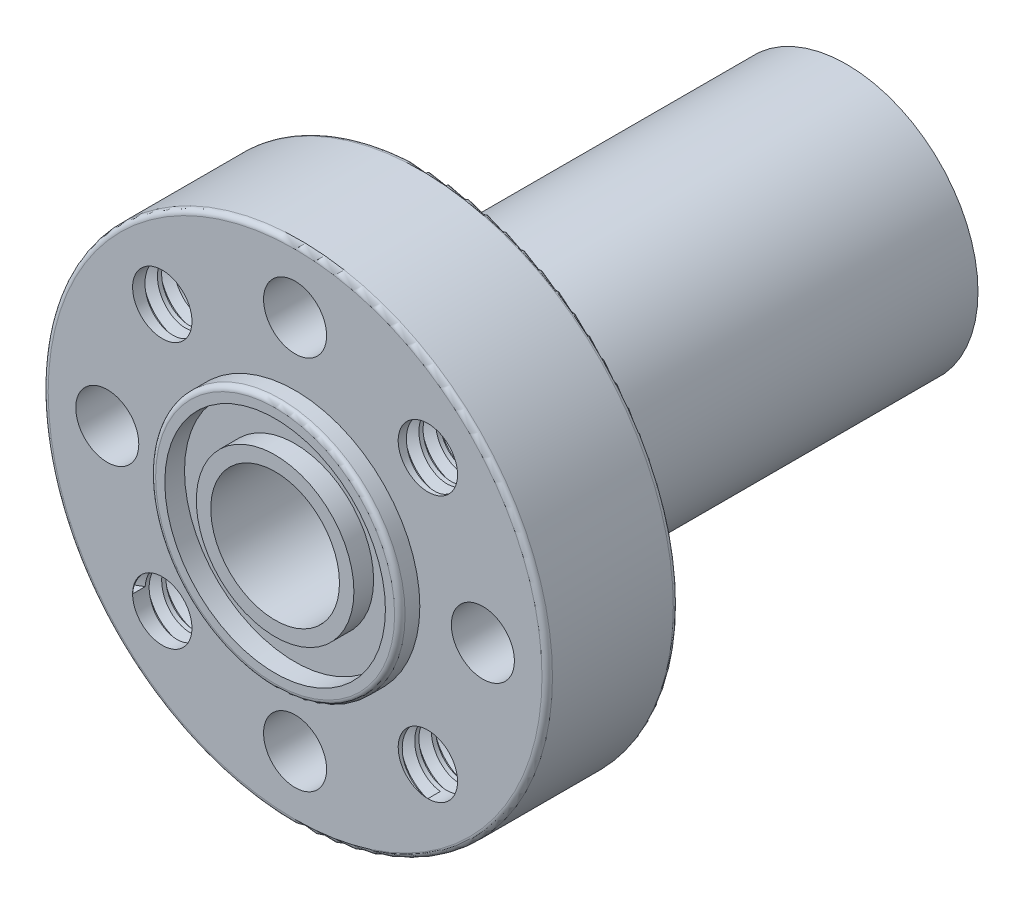
from build123d import *

# Parameters (mm, degrees)
SKETCH1_R           = 9.6
BOSS_EXTRUDE1_DEPTH = 5
SKETCH4_R           = 4.75
BOSS_EXTRUDE4_DEPTH = 0.76
SKETCH5_R           = 2.45
CUT_EXTRUDE2_DEPTH  = 15.747799836
SKETCH6_R           = 4.2
SKETCH6_R_2         = 3
CUT_EXTRUDE3_DEPTH  = 0.75
FILLET1_R           = 0.2
SKETCH7_R           = 1.2
CUT_EXTRUDE5_DEPTH  = 15.467895626
SKETCH9_R           = 1.13
CUT_EXTRUDE4_DEPTH  = 15.467895626
THREAD1_PITCH       = 0.635
CIRPATTERN1_COUNT   = 4
SKETCH21_R          = 5
SKETCH21_R_2        = 4
BOSS_EXTRUDE5_DEPTH = 16


with BuildPart() as part:
    # Sketch1 → Boss-Extrude1 (new body)
    with BuildSketch(Plane.XY):
        Circle(SKETCH1_R)
    extrude(amount=BOSS_EXTRUDE1_DEPTH)

    # Sketch4 → Boss-Extrude4 (add)
    with BuildSketch(Plane.XY.offset(5)):
        Circle(SKETCH4_R)
    extrude(amount=BOSS_EXTRUDE4_DEPTH)

    # Sketch5 → Cut-Extrude2 (cut, through all)
    with BuildSketch(Plane.XY.offset(5.76)):
        Circle(SKETCH5_R)
    extrude(amount=-CUT_EXTRUDE2_DEPTH, mode=Mode.SUBTRACT)

    # Sketch6 → Cut-Extrude3 (cut)
    with BuildSketch(Plane.XY.offset(5.76)):
        Circle(SKETCH6_R)
        Circle(SKETCH6_R_2, mode=Mode.SUBTRACT)
    extrude(amount=-CUT_EXTRUDE3_DEPTH, mode=Mode.SUBTRACT)

    # Fillet1
    fillet1_edges = [part.edges().sort_by_distance(p)[0] for p in [
        (-9.6, 0, 0),
        (-9.6, 0, 5),
        (-4.75, 0, 5.76),
    ]]
    fillet(fillet1_edges, radius=FILLET1_R)

    # Sketch7 → Cut-Extrude5 (cut, through all)
    with BuildSketch(Plane.XY.offset(5)):
        with Locations((0, -7.15)):
            Circle(SKETCH7_R)
    cut_extrude5 = extrude(amount=-CUT_EXTRUDE5_DEPTH, mode=Mode.SUBTRACT)

    # Sketch9 → Cut-Extrude4 (cut, through all)
    with BuildSketch(Plane.XY.offset(5)):
        with Locations((-5.055813485, -5.055813485)):
            Circle(SKETCH9_R)
    cut_extrude4 = extrude(amount=-CUT_EXTRUDE4_DEPTH, mode=Mode.SUBTRACT)

    # Thread1: the profile of Thread Profile2 profile screwed along a right-hand helix of 7.874016 turns, 6 arcs to a turn; built about Z, then put on its axis
    thread1_z = Axis((0, 0, 0), (0, 0, 1))
    thread1_corners = [(1.1297, 0, -0.000173205), (1.473703831, 0, 0.198437499), (1.473703831, 0, 0.277812499), (1.1297, 0, 0.476423203)]
    with BuildLine(mode=Mode.PRIVATE) as thread1_profile:
        Line(thread1_corners[0], thread1_corners[1])
        Line(thread1_corners[1], thread1_corners[2])
        Line(thread1_corners[2], thread1_corners[3])
        Line(thread1_corners[3], thread1_corners[0])
    thread1_cap = Face(thread1_profile.wire())
    thread1_turn_angles = [0, 30, 60, 90, 120, 150, 180, 210, 240, 270, 300, 330, 360]
    thread1_turn_weights = [1, 0.8660254037844387, 1, 0.8660254037844387, 1, 0.8660254037844387, 1, 0.8660254037844387, 1, 0.8660254037844387, 1, 0.8660254037844387, 1]
    thread1_turn_rails = [Edge.make_bspline([Vector(p[0], p[1], 0).rotate(thread1_z, thread1_turn_angles[k]) / thread1_turn_weights[k] + Vector(0, 0, p[2] + THREAD1_PITCH * thread1_turn_angles[k] / 360) for k in range(13)], [0, 0, 0, 1, 1, 2, 2, 3, 3, 4, 4, 5, 5, 6, 6, 6], 2, thread1_turn_weights) for p in thread1_corners]
    thread1_turn_sides = [Face.make_surface_from_curves(thread1_turn_rails[p[0]], thread1_turn_rails[p[1]]) for p in [(0, 1), (1, 2), (2, 3), (3, 0)]]
    thread1_last_angles = [2520, 2550, 2580, 2610, 2640, 2670, 2700, 2730, 2760, 2790, 2820, 2827.322834646, 2834.645669291]
    thread1_last_weights = [1, 0.8660254037844387, 1, 0.8660254037844387, 1, 0.8660254037844387, 1, 0.8660254037844387, 1, 0.8660254037844387, 1, 0.9918437235207201, 1]
    thread1_last_rails = [Edge.make_bspline([Vector(p[0], p[1], 0).rotate(thread1_z, thread1_last_angles[k]) / thread1_last_weights[k] + Vector(0, 0, p[2] + THREAD1_PITCH * thread1_last_angles[k] / 360) for k in range(13)], [0, 0, 0, 1, 1, 2, 2, 3, 3, 4, 4, 5, 5, 6, 6, 6], 2, thread1_last_weights) for p in thread1_corners]
    thread1_last_sides = [Face.make_surface_from_curves(thread1_last_rails[p[0]], thread1_last_rails[p[1]]) for p in [(0, 1), (1, 2), (2, 3), (3, 0)]]
    thread1 = Plane(origin=(-5.055813485, -5.055813485, 5), x_dir=(-1, 0, 0), z_dir=(0, 0, -1)) * Solid(Shell([*[p.moved(Location((0, 0, THREAD1_PITCH * i))) for i in range(7) for p in thread1_turn_sides], *thread1_last_sides, thread1_cap, thread1_cap.rotate(thread1_z, 2834.645669291).moved(Location((0, 0, THREAD1_PITCH * 2834.645669291 / 360)))]))
    add(thread1, mode=Mode.SUBTRACT)

    # CirPattern1: Cut-Extrude5, Cut-Extrude4, Thread1 ×4 about axis
    cirpattern1_axis = Axis((0, 0, 6.394387537), (0, 0, -1))
    add([cut_extrude5.rotate(cirpattern1_axis, i * 360 / CIRPATTERN1_COUNT) for i in range(1, CIRPATTERN1_COUNT)], mode=Mode.SUBTRACT)
    add([cut_extrude4.rotate(cirpattern1_axis, i * 360 / CIRPATTERN1_COUNT) for i in range(1, CIRPATTERN1_COUNT)], mode=Mode.SUBTRACT)
    add([thread1.rotate(cirpattern1_axis, i * 360 / CIRPATTERN1_COUNT) for i in range(1, CIRPATTERN1_COUNT)], mode=Mode.SUBTRACT)

    # Sketch21 → Boss-Extrude5 (add)
    with BuildSketch(Plane(origin=(0, 0, 0), x_dir=(-1, 0, 0), z_dir=(0, 0, -1))):
        with Locations(Location((0, 0, 0), (0, 0, 180))):
            Circle(SKETCH21_R)
        Circle(SKETCH21_R_2, mode=Mode.SUBTRACT)
    extrude(amount=BOSS_EXTRUDE5_DEPTH)


solid = part.part
